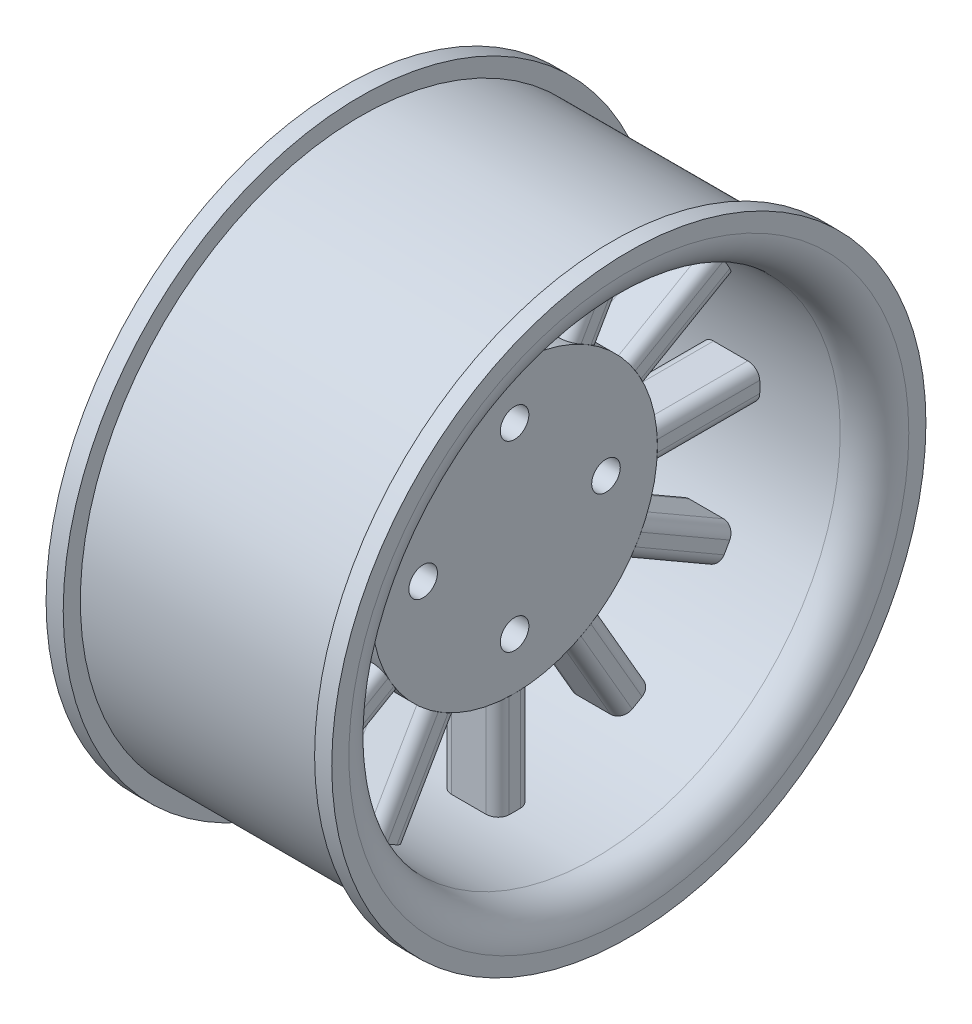
from build123d import *

# Parameters (mm, degrees)
SKETCH_1_R               = 24.5
EXTRUDE_1_DEPTH          = 22
SKETCH_2_R               = 26
EXTRUDE_2_DEPTH          = 1.5
EXTRUDE_START            = 1.5
SKETCH_3_R               = 26
EXTRUDE_3_DEPTH          = 1.5
SKETCH_4_R               = 17.5
CUT_EXTRUDE_1_DEPTH      = 10
SKETCH_5_R               = 1.25
CUT_EXTRUDE_2_DEPTH      = 40.711459303
SKETCH_6_R               = 4.3
SKETCH_6_R_2             = 2.5
EXTRUDE_4_DEPTH          = 10
SKETCH_8_R               = 21.5
SKETCH_8_R_2             = 12.5
CUT_EXTRUDE_4_DEPTH      = 45.463468151
EXTRUDE_START_2          = -15
EXTRUDE_5_DEPTH          = 15.000012
FILLET_2_R               = 3
FILLET_5_R               = 3
SKETCH_15_R              = 21.5
CUT_EXTRUDE_10_DEPTH     = 10
FILLET_9_R               = 1
PATTERN_CIRCULAR_1_COUNT = 12


# Read off the part's stored shape, not the designer's step: 凸台-拉伸5
with BuildPart() as part:
    # 草图1 → 凸台-拉伸1 (new body)
    with BuildSketch(Plane(origin=(0, 0, 0), x_dir=(0, 0, -1), z_dir=(1, 0, 0))):
        Circle(SKETCH_1_R)
    extrude(amount=EXTRUDE_1_DEPTH)

    # 草图2 → 凸台-拉伸2 (add)
    with BuildSketch(Plane(origin=(22, 0, 0), x_dir=(0, 0, -1), z_dir=(1, 0, 0))):
        Circle(SKETCH_2_R)
    extrude(amount=EXTRUDE_2_DEPTH)

    # 草图3 → 凸台-拉伸3 (add)
    with BuildSketch(Plane.ZY.offset(EXTRUDE_START)):
        with Locations(Location((0, 0, 0), (0, 0, 180))):
            Circle(SKETCH_3_R)
    extrude(amount=-EXTRUDE_3_DEPTH)

    # 草图4 → 切除-拉伸1 (cut)
    with BuildSketch(Plane.ZY.offset(1.5)):
        Circle(SKETCH_4_R)
    extrude(amount=-CUT_EXTRUDE_1_DEPTH, mode=Mode.SUBTRACT)

    # 草图5 → 切除-拉伸2 (cut, through all)
    with BuildSketch(Plane.ZY.offset(-8.5)):
        with Locations((0, 8)):
            Circle(SKETCH_5_R)
        with Locations((8, 0)):
            Circle(SKETCH_5_R)
        with Locations((0, -8)):
            Circle(SKETCH_5_R)
        with Locations((-8, 0)):
            Circle(SKETCH_5_R)
    extrude(amount=-CUT_EXTRUDE_2_DEPTH, mode=Mode.SUBTRACT)

    # 草图6 → 凸台-拉伸4 (add, through all)
    with BuildSketch(Plane.ZY.offset(-8.5)):
        Circle(SKETCH_6_R)
        Circle(SKETCH_6_R_2, mode=Mode.SUBTRACT)
    extrude(amount=EXTRUDE_4_DEPTH)

    # 草图8 → 切除-拉伸4 (cut, through all)
    with BuildSketch(Plane(origin=(23.5, 0, 0), x_dir=(0, 0, -1), z_dir=(1, 0, 0))):
        Circle(SKETCH_8_R)
        Circle(SKETCH_8_R_2, mode=Mode.SUBTRACT)
    extrude(amount=-CUT_EXTRUDE_4_DEPTH, mode=Mode.SUBTRACT)


with BuildPart() as cut_extrude_4_piece_1:
    # of the separate pieces the step leaves, piece 1, a body of its own (cut_extrude_4_pieces)
    add(part.part.solids().sort_by_distance((-1.5, 0, -26))[0])

    # 圆角2
    fillet_2_edges = [cut_extrude_4_piece_1.edges().sort_by_distance(p)[0] for p in [
        (23.5, 0, 21.5),
    ]]
    fillet(fillet_2_edges, radius=FILLET_2_R)

    # 圆角5
    fillet_5_edges = [cut_extrude_4_piece_1.edges().sort_by_distance(p)[0] for p in [
        (-1.5, 0, 21.5),
    ]]
    fillet(fillet_5_edges, radius=FILLET_5_R)


with BuildPart() as cut_extrude_4_piece_2:
    # of the separate pieces the step leaves, piece 2, a body of its own (cut_extrude_4_pieces)
    add(part.part.solids().sort_by_distance((23.5, 0, -12.5))[0])


with BuildPart() as body_3:
    # 凸台-拉伸5 outline → 凸台-拉伸5 (new body)
    with BuildSketch(Plane(origin=(23.5, 0, 0), x_dir=(0, 0, -1), z_dir=(1, 0, 0)).offset(EXTRUDE_START_2)):
        with BuildLine():
            Line((1.5, 12.409673646), (1.5, 21.409279718))
            ThreePointArc((1.5, 21.409279718), (0, 21.461762697), (-1.5, 21.409279718))
            Line((-1.5, 21.409279718), (-1.5, 12.409673646))
            ThreePointArc((-1.5, 12.409673646), (0, 12.5), (1.5, 12.409673646))
        make_face()
    extrude(amount=EXTRUDE_5_DEPTH)


with BuildPart() as cut_extrude_10_tool:
    # 草图15 → 切除-拉伸10 (new body)
    with BuildSketch(Plane(origin=(23.500012, 0, 0), x_dir=(0, 0, -1), z_dir=(1, 0, 0))):
        Circle(SKETCH_15_R)
    extrude(amount=-CUT_EXTRUDE_10_DEPTH)


with BuildPart() as cut_extrude_4_piece_2_1:
    add(cut_extrude_4_piece_2.part)

    # 切除-拉伸10: cut by cut_extrude_10_tool
    add(cut_extrude_10_tool.part, mode=Mode.SUBTRACT)


with BuildPart() as body_3_1:
    add(body_3.part)

    # 切除-拉伸10: cut by cut_extrude_10_tool
    add(cut_extrude_10_tool.part, mode=Mode.SUBTRACT)

    # 圆角9
    fillet_9_edges = [body_3_1.edges().sort_by_distance(p)[0] for p in [
        (8.5, 16.909476682, 1.5),
        (8.5, 16.909476682, -1.5),
        (13.500012, 16.909476682, 1.5),
        (13.500012, 16.909476682, -1.5),
    ]]
    fillet(fillet_9_edges, radius=FILLET_9_R)


with BuildPart() as pattern_circular_1_1:
    # 阵列(圆周)1: pattern copy
    add(body_3_1.part.rotate(Axis((0, 0, 0), (1, 0, 0)), 1 * 360 / PATTERN_CIRCULAR_1_COUNT))


with BuildPart() as pattern_circular_1_2:
    # 阵列(圆周)1: pattern copy
    add(body_3_1.part.rotate(Axis((0, 0, 0), (1, 0, 0)), 2 * 360 / PATTERN_CIRCULAR_1_COUNT))


with BuildPart() as pattern_circular_1_3:
    # 阵列(圆周)1: pattern copy
    add(body_3_1.part.rotate(Axis((0, 0, 0), (1, 0, 0)), 3 * 360 / PATTERN_CIRCULAR_1_COUNT))


with BuildPart() as pattern_circular_1_4:
    # 阵列(圆周)1: pattern copy
    add(body_3_1.part.rotate(Axis((0, 0, 0), (1, 0, 0)), 4 * 360 / PATTERN_CIRCULAR_1_COUNT))


with BuildPart() as pattern_circular_1_5:
    # 阵列(圆周)1: pattern copy
    add(body_3_1.part.rotate(Axis((0, 0, 0), (1, 0, 0)), 5 * 360 / PATTERN_CIRCULAR_1_COUNT))


with BuildPart() as pattern_circular_1_6:
    # 阵列(圆周)1: pattern copy
    add(body_3_1.part.rotate(Axis((0, 0, 0), (1, 0, 0)), 6 * 360 / PATTERN_CIRCULAR_1_COUNT))


with BuildPart() as pattern_circular_1_7:
    # 阵列(圆周)1: pattern copy
    add(body_3_1.part.rotate(Axis((0, 0, 0), (1, 0, 0)), 7 * 360 / PATTERN_CIRCULAR_1_COUNT))


with BuildPart() as pattern_circular_1_8:
    # 阵列(圆周)1: pattern copy
    add(body_3_1.part.rotate(Axis((0, 0, 0), (1, 0, 0)), 8 * 360 / PATTERN_CIRCULAR_1_COUNT))


with BuildPart() as pattern_circular_1_9:
    # 阵列(圆周)1: pattern copy
    add(body_3_1.part.rotate(Axis((0, 0, 0), (1, 0, 0)), 9 * 360 / PATTERN_CIRCULAR_1_COUNT))


with BuildPart() as pattern_circular_1_10:
    # 阵列(圆周)1: pattern copy
    add(body_3_1.part.rotate(Axis((0, 0, 0), (1, 0, 0)), 10 * 360 / PATTERN_CIRCULAR_1_COUNT))


with BuildPart() as pattern_circular_1_11:
    # 阵列(圆周)1: pattern copy
    add(body_3_1.part.rotate(Axis((0, 0, 0), (1, 0, 0)), 11 * 360 / PATTERN_CIRCULAR_1_COUNT))


solid = Compound([cut_extrude_4_piece_1.part, cut_extrude_4_piece_2_1.part, body_3_1.part, pattern_circular_1_1.part, pattern_circular_1_2.part, pattern_circular_1_3.part, pattern_circular_1_4.part, pattern_circular_1_5.part, pattern_circular_1_6.part, pattern_circular_1_7.part, pattern_circular_1_8.part, pattern_circular_1_9.part, pattern_circular_1_10.part, pattern_circular_1_11.part])
